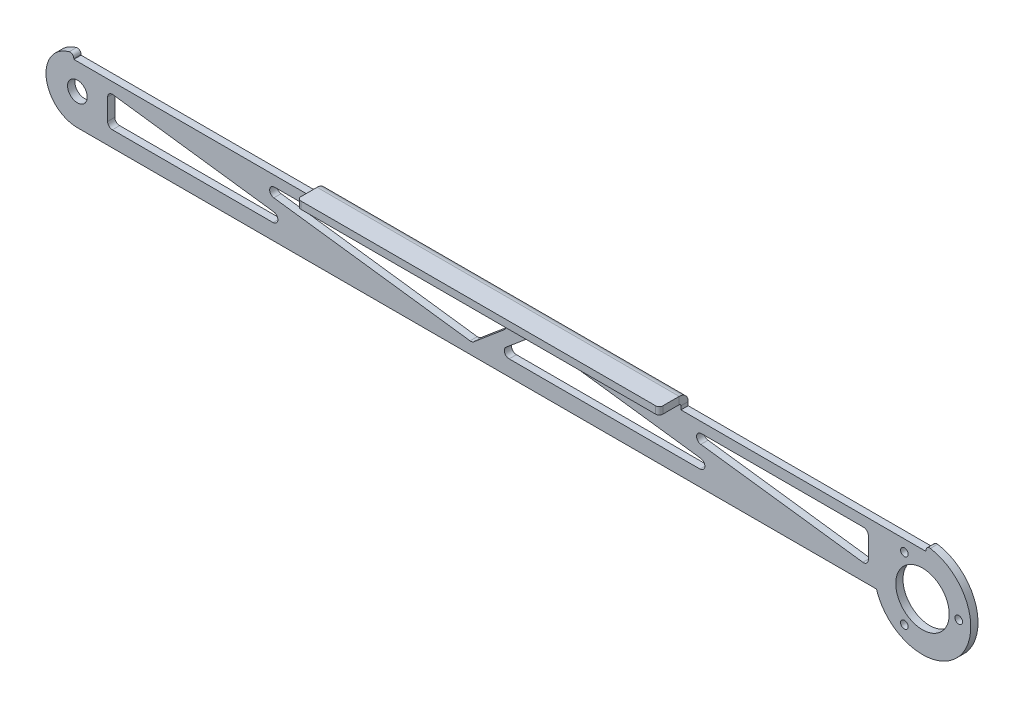
from build123d import *

# Parameters (mm, degrees)
BASE_FLANGE1_DEPTH            = 3
EDGE_FLANGE2_STRIP_W          = 13.4732
EDGE_FLANGE2_STRIP_H          = 3
EDGE_FLANGE2_STRIP_CUT_DEPTH  = 349.93
EDGE_FLANGE2_RELIEF_W         = 14.9732
EDGE_FLANGE2_RELIEF_H         = 1.5
EDGE_FLANGE2_RELIEF_CUT_DEPTH = 3
EDGE_FLANGE2_DEPTH            = 349.93
CUT_EXTRUDE1_DEPTH            = 372.023186472
CUT_EXTRUDE1_DEPTH_BACK       = 372.023186472
SKETCH22_R                    = 4.075
SKETCH22_R_2                  = 11.075
SKETCH22_R_3                  = 1.575
CUT_EXTRUDE2_DEPTH            = 372.023186472
CUT_EXTRUDE2_DEPTH_BACK       = 372.023186472
FILLET1_R                     = 2
CUT_EXTRUDE3_DEPTH            = 372.023186472
CUT_EXTRUDE3_DEPTH_BACK       = 372.023186472
SKETCH24_W                    = 100
SKETCH24_H                    = 5.2366
FILLET2_R                     = 1.5


# Sheet-metal steps are written as plain solids
with BuildPart() as part:
    # Sketch1 → Base-Flange1 (new body)
    with BuildSketch(Plane.XY):
        with BuildLine():
            Line((0, 13), (349.93, 13))
            ThreePointArc((349.93, 13), (366.054515497, -18.832159566), (330.851215972, -13))
            Line((330.851215972, -13), (0, -13))
            ThreePointArc((0, -13), (-13, 0), (0, 13))
        make_face()
    extrude(amount=-BASE_FLANGE1_DEPTH)

    # Edge-Flange2 strip (across the edge) → Edge-Flange2 strip cut (cut)
    with BuildSketch(Plane(origin=(349.93, 13, 0), x_dir=(0, -1, 0), z_dir=(-1, 0, 0))):
        with Locations((-6, -1.5)):
            Rectangle(EDGE_FLANGE2_STRIP_W, EDGE_FLANGE2_STRIP_H)
    extrude(amount=EDGE_FLANGE2_STRIP_CUT_DEPTH, mode=Mode.SUBTRACT)

    # Edge-Flange2 relief (on the sheet) → Edge-Flange2 relief cut (cut)
    with BuildSketch(Plane(origin=(349.93, 12.2634, 0), x_dir=(0, -1, 0), z_dir=(0, 0, 1))):
        with Locations((-5.9866, 0.75)):
            Rectangle(EDGE_FLANGE2_RELIEF_W, EDGE_FLANGE2_RELIEF_H)
        with Locations((-5.9866, -350.68)):
            Rectangle(EDGE_FLANGE2_RELIEF_W, EDGE_FLANGE2_RELIEF_H)
    extrude(amount=-EDGE_FLANGE2_RELIEF_CUT_DEPTH, mode=Mode.SUBTRACT)

    # Edge-Flange2 section (across the edge) → Edge-Flange2 (add)
    with BuildSketch(Plane(origin=(349.93, 13, 0), x_dir=(0, -1, 0), z_dir=(-1, 0, 0))):
        with BuildLine():
            Line((-3, 0.7366), (-3, 9))
            Line((-3, 9), (0, 9))
            Line((0, 9), (0, 0.7366))
            ThreePointArc((0, 0.7366), (0.215745145, 0.215745145), (0.7366, 0))
            Line((0.7366, 0), (0.7366, -3))
            ThreePointArc((0.7366, -3), (-1.905575199, -1.905575199), (-3, 0.7366))
        make_face()
    extrude(amount=EDGE_FLANGE2_DEPTH)

    # Sketch22 → Cut-Extrude1 (cut, two sides: drawn at the far end of the back side and taken through both)
    with BuildSketch(Plane.XY.offset(-CUT_EXTRUDE1_DEPTH_BACK)):
        Circle(SKETCH22_R)
        with Locations((349.93, -7)):
            Circle(SKETCH22_R_2)
        with Locations((364.93, -7)):
            Circle(SKETCH22_R_3)
        with Locations((342.43, 5.990381057)):
            Circle(SKETCH22_R_3)
        with Locations((342.43, -19.990381057)):
            Circle(SKETCH22_R_3)
    extrude(amount=CUT_EXTRUDE1_DEPTH + CUT_EXTRUDE1_DEPTH_BACK, mode=Mode.SUBTRACT)

    # Sketch23 → Cut-Extrude2 (cut, two sides: drawn at the far end of the back side and taken through both)
    with BuildSketch(Plane.XY.offset(-CUT_EXTRUDE2_DEPTH_BACK)):
        Polygon((12.5, 6.5), (12.5, -6.5), (111.651399385, -6.5), align=None)
        Polygon((327.5, -6.5), (327.5, 6.5), (227.5, 6.5), align=None)
        Polygon((50.961538462, 6.5), (163.478075869, -8.252338296), (180.961538462, 6.5), align=None)
        Polygon((173.308112114, -6.5), (288.714823182, -6.5), (188.714823182, 6.5), align=None)
    extrude(amount=CUT_EXTRUDE2_DEPTH + CUT_EXTRUDE2_DEPTH_BACK, mode=Mode.SUBTRACT)

    # Fillet1
    fillet1_edges = [part.edges().sort_by_distance(p)[0] for p in [
        (327.5, -6.5, -1.5),
        (227.5, 6.5, -1.5),
        (327.5, 6.5, -1.5),
        (50.961538462, 6.5, -1.5),
        (180.961538462, 6.5, -1.5),
        (163.478075869, -8.252338296, -1.5),
        (173.308112114, -6.5, -1.5),
        (188.714823182, 6.5, -1.5),
        (288.714823182, -6.5, -1.5),
        (12.5, 6.5, -1.5),
        (111.651399385, -6.5, -1.5),
        (12.5, -6.5, -1.5),
        (349.93, 14.5, 9),
        (0, 14.5, 9),
    ]]
    fillet(fillet1_edges, radius=FILLET1_R)

    # Sketch24 → Cut-Extrude3 (cut, two sides: drawn at the far end of the back side and taken through both)
    with BuildSketch(Plane.XY.offset(-CUT_EXTRUDE3_DEPTH_BACK)):
        with Locations((50, 13.3817)):
            Rectangle(SKETCH24_W, SKETCH24_H)
        with Locations((299.93, 13.3817)):
            Rectangle(SKETCH24_W, SKETCH24_H)
    extrude(amount=CUT_EXTRUDE3_DEPTH + CUT_EXTRUDE3_DEPTH_BACK, mode=Mode.SUBTRACT)

    # Fillet2
    fillet2_edges = [part.edges().sort_by_distance(p)[0] for p in [
        (351.43, 12.943670675, -1.5),
        (-1.5, 12.91317157, -1.5),
        (100, 14.5, 9),
        (249.93, 14.5, 9),
    ]]
    fillet(fillet2_edges, radius=FILLET2_R)


solid = part.part
